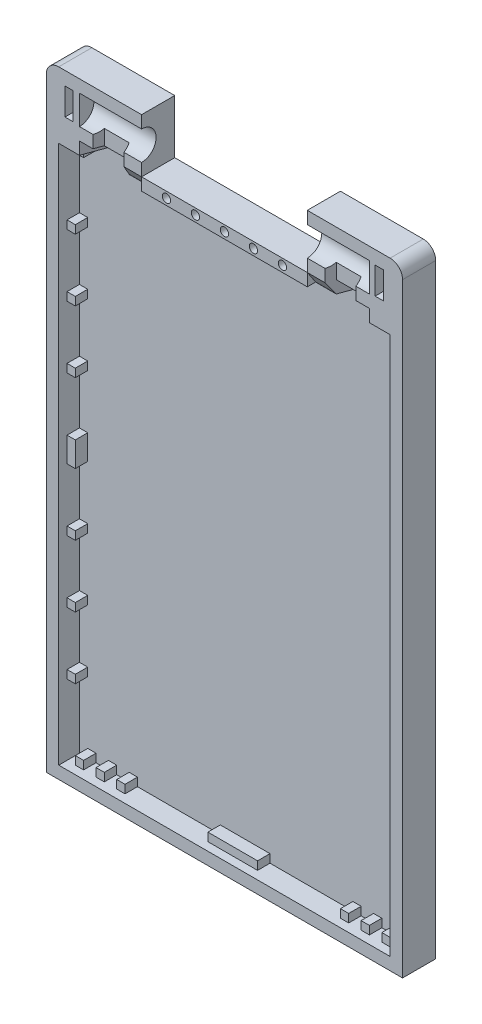
from build123d import *
from OCP.BRepFilletAPI import BRepFilletAPI_MakeChamfer

# Parameters (mm, degrees)
Y_KSEKLIK_EKSTR_ZYON1_DEPTH  = 8
IZIM1_4_W                    = 20
IZIM1_4_H                    = 13
IZIM1_4_W_2                  = 2
IZIM1_4_H_2                  = 6.5
Y_KSEKLIK_EKSTR_ZYON3_DEPTH  = 8
Y_KSEKLIK_EKSTR_ZYON4_DEPTH  = 3
Y_KSEKLIK_EKSTR_ZYON5_DEPTH  = 6
KES_EKSTR_ZYON1_DEPTH        = 15
KES_EKSTR_ZYON2_START        = 55
KES_EKSTR_ZYON2_DEPTH        = 55
IZIM7_W                      = 6
IZIM7_H                      = 4
KES_EKSTR_ZYON5_DEPTH        = 2
PAH1_SIZE2                   = 3
PAH1_SIZE                    = 1.091910703
PAH2_SIZE2                   = 3
PAH2_SIZE                    = 1.091910703
PAH3_SIZE                    = 1.819851171
PAH3_SIZE_2                  = 5
PAH4_SIZE                    = 0.727940469
PAH4_SIZE_2                  = 2
PAH5_SIZE                    = 2
PAH5_SIZE_2                  = 2.965121937
IZIM11_R                     = 1
Y_KSEKLIK_EKSTR_ZYON10_DEPTH = 2
IZIM12_W                     = 2
IZIM12_H                     = 6
IZIM12_H_2                   = 2
IZIM12_W_2                   = 12
Y_KSEKLIK_EKSTR_ZYON12_DEPTH = 3


# Some blends are built 0.0001 mm under size
with BuildPart() as part:
    # Çizim1 → Yükseklik-Ekstrüzyon1 (new body)
    with BuildSketch(Plane.XY):
        with BuildLine():
            Line((-27.993672713, -28.466538806), (-27.993672713, 101.533461194))
            Line((-27.993672713, 101.533461194), (-22.993672713, 101.533461194))
            Line((-22.993672713, 101.533461194), (-22.993672713, 104.533461194))
            Line((-22.993672713, 104.533461194), (-27.993672713, 104.533461194))
            Line((-27.993672713, 104.533461194), (-27.993672713, 117.533461194))
            ThreePointArc((-27.993672713, 117.533461194), (-30.114993056, 116.654781538), (-30.993672713, 114.533461194))
            Line((-30.993672713, 114.533461194), (-30.993672713, 104.533461194))
            Line((-30.993672713, 104.533461194), (-30.993672713, -31.466538806))
            Line((-30.993672713, -31.466538806), (55.006327287, -31.466538806))
            Line((55.006327287, -31.466538806), (55.006327287, 104.533461194))
            Line((55.006327287, 104.533461194), (55.006327287, 114.533461194))
            ThreePointArc((55.006327287, 114.533461194), (54.127647631, 116.654781538), (52.006327287, 117.533461194))
            Line((52.006327287, 117.533461194), (52.006327287, 104.533461194))
            Line((52.006327287, 104.533461194), (47.006327287, 104.533461194))
            Line((47.006327287, 104.533461194), (47.006327287, 101.533461194))
            Line((47.006327287, 101.533461194), (52.006327287, 101.533461194))
            Line((52.006327287, 101.533461194), (52.006327287, -28.466538806))
            Line((52.006327287, -28.466538806), (-27.993672713, -28.466538806))
        make_face()
    extrude(amount=Y_KSEKLIK_EKSTR_ZYON1_DEPTH)

    # Çizim1<4> → Yükseklik-Ekstrüzyon3 (add)
    # profile 1 of 2: a face of its own
    with BuildSketch(Plane.XY):
        with Locations((-17.993672713, 111.033461194)):
            Rectangle(IZIM1_4_W, IZIM1_4_H)
        with Locations((-25.493672713, 111.033461194)):
            Rectangle(IZIM1_4_W_2, IZIM1_4_H_2, mode=Mode.SUBTRACT)
    # profile 2 of 2: a face of its own
    with BuildSketch(Plane.XY):
        with Locations((42.006327287, 111.033461194)):
            Rectangle(IZIM1_4_W, IZIM1_4_H)
        with Locations((49.389217742, 111.033461194)):
            Rectangle(IZIM1_4_W_2, IZIM1_4_H_2, mode=Mode.SUBTRACT)
    extrude(amount=Y_KSEKLIK_EKSTR_ZYON3_DEPTH)

    # Çizim1<6> → Yükseklik-Ekstrüzyon4 (add)
    with BuildSketch(Plane.XY):
        Polygon((-12.993672713, 101.533461194), (37.006327287, 101.533461194), (37.006327287, 104.533461194), (47.006327287, 104.533461194), (47.006327287, 101.533461194), (52.006327287, 101.533461194), (52.006327287, -28.466538806), (-27.993672713, -28.466538806), (-27.993672713, 101.533461194), (-22.993672713, 101.533461194), (-22.993672713, 104.533461194), (-12.993672713, 104.533461194), align=None)
    extrude(amount=Y_KSEKLIK_EKSTR_ZYON4_DEPTH)

    # Çizim1<7> → Yükseklik-Ekstrüzyon5 (add)
    with BuildSketch(Plane.XY):
        Polygon((-12.993672713, 104.533461194), (-12.993672713, 101.533461194), (37.006327287, 101.533461194), (37.006327287, 104.533461194), (32.006327287, 104.533461194), (-7.993672713, 104.533461194), align=None)
    extrude(amount=Y_KSEKLIK_EKSTR_ZYON5_DEPTH)

    # Çizim2 → Kes-Ekstrüzyon1 (cut)
    with BuildSketch(Plane.ZY.offset(-32.006327287)):
        with BuildLine():
            Line((8, 107.533461194), (8, 114.533461194))
            ThreePointArc((8, 114.533461194), (4.5, 111.033461194), (8, 107.533461194))
        make_face()
    extrude(amount=-KES_EKSTR_ZYON1_DEPTH, mode=Mode.SUBTRACT)

    # Çizim2<3> → Kes-Ekstrüzyon2 (cut)
    with BuildSketch(Plane.ZY.offset(-32.006327287).offset(KES_EKSTR_ZYON2_START)):
        with BuildLine():
            Line((8, 107.533461194), (8, 114.533461194))
            ThreePointArc((8, 114.533461194), (4.5, 111.033461194), (8, 107.533461194))
        make_face()
    extrude(amount=-KES_EKSTR_ZYON2_DEPTH, mode=Mode.SUBTRACT)

    # Çizim7 → Kes-Ekstrüzyon5 (cut)
    with BuildSketch(Plane.XY.offset(8)):
        with Locations((-15.993672713, 106.533461194)):
            Rectangle(IZIM7_W, IZIM7_H)
        with Locations((40.006327287, 106.533461194)):
            Rectangle(IZIM7_W, IZIM7_H)
    extrude(amount=-KES_EKSTR_ZYON5_DEPTH, mode=Mode.SUBTRACT)

    # Pah1
    pah1_edges = [part.edges().sort_by_distance(p)[0] for p in [
        (37.006327287, 103.033461194, 3),
    ]]
    pah1_side = [part.faces().sort_by_distance(p)[0] for p in [
        (37.028165501, 103.033461194, 3),
    ]]
    chamfer(pah1_edges, length=PAH1_SIZE - 0.0001, length2=PAH1_SIZE2 - 0.0001, reference=pah1_side[0])  # a hair under: the kernel refuses the full size

    # Pah2
    pah2_edges = [part.edges().sort_by_distance(p)[0] for p in [
        (-12.993672713, 103.033461194, 3),
    ]]
    pah2_side = [part.faces().sort_by_distance(p)[0] for p in [
        (-13.015510927, 103.033461194, 3),
    ]]
    chamfer(pah2_edges, length=PAH2_SIZE - 0.0001, length2=PAH2_SIZE2 - 0.0001, reference=pah2_side[0])  # a hair under: the kernel refuses the full size

    # Pah3
    pah3_edges_1 = [part.edges().sort_by_distance(p)[0] for p in [
        (47.006327287, 103.033461194, 3),
    ]]
    pah3_side_1 = [part.faces().sort_by_distance(p)[0] for p in [
        (46.969930264, 103.033461194, 3),
    ]]
    pah3_edges_2 = [part.edges().sort_by_distance(p)[0] for p in [
        (-22.993672713, 103.033461194, 3),
    ]]
    pah3_side_2 = [part.faces().sort_by_distance(p)[0] for p in [
        (-22.957275689, 103.033461194, 3),
    ]]
    pah3 = BRepFilletAPI_MakeChamfer(part.part.solid().wrapped)
    for e in pah3_edges_1:
        pah3.Add(PAH3_SIZE - 0.0001, PAH3_SIZE_2 - 0.0001, e.wrapped, pah3_side_1[0].wrapped)
    for e in pah3_edges_2:
        pah3.Add(PAH3_SIZE - 0.0001, PAH3_SIZE_2 - 0.0001, e.wrapped, pah3_side_2[0].wrapped)
    add(Compound.cast(pah3.Shape()), mode=Mode.REPLACE)  # a hair under: the kernel refuses the full size

    # Pah4
    pah4_edges_1 = [part.edges().sort_by_distance(p)[0] for p in [
        (-18.993672713, 106.033461194, 8),
    ]]
    pah4_side_1 = [part.faces().sort_by_distance(p)[0] for p in [
        (-19.008231522, 106.033461194, 8),
    ]]
    pah4_edges_2 = [part.edges().sort_by_distance(p)[0] for p in [
        (-12.993672713, 106.033461194, 8),
    ]]
    pah4_side_2 = [part.faces().sort_by_distance(p)[0] for p in [
        (-12.993672713, 106.033461194, 7.985441191),
    ]]
    pah4_edges_3 = [part.edges().sort_by_distance(p)[0] for p in [
        (37.006327287, 106.033461194, 8),
    ]]
    pah4_side_3 = [part.faces().sort_by_distance(p)[0] for p in [
        (36.991768478, 106.033461194, 8),
    ]]
    pah4_edges_4 = [part.edges().sort_by_distance(p)[0] for p in [
        (43.006327287, 106.033461194, 8),
    ]]
    pah4_side_4 = [part.faces().sort_by_distance(p)[0] for p in [
        (43.020886097, 106.033461194, 8),
    ]]
    pah4 = BRepFilletAPI_MakeChamfer(part.part.solid().wrapped)
    for e in pah4_edges_1:
        pah4.Add(PAH4_SIZE - 0.0001, PAH4_SIZE_2 - 0.0001, e.wrapped, pah4_side_1[0].wrapped)
    for e in pah4_edges_2:
        pah4.Add(PAH4_SIZE_2 - 0.0001, PAH4_SIZE - 0.0001, e.wrapped, pah4_side_2[0].wrapped)
    for e in pah4_edges_3:
        pah4.Add(PAH4_SIZE - 0.0001, PAH4_SIZE_2 - 0.0001, e.wrapped, pah4_side_3[0].wrapped)
    for e in pah4_edges_4:
        pah4.Add(PAH4_SIZE - 0.0001, PAH4_SIZE_2 - 0.0001, e.wrapped, pah4_side_4[0].wrapped)
    add(Compound.cast(pah4.Shape()), mode=Mode.REPLACE)  # a hair under: the kernel refuses the full size

    # Pah5
    # the kernel refuses this chamfer: 2.965121937, 2 mm, written as the material it adds along each edge
    with BuildSketch(Plane(origin=(-12.993672713, 104.533461194, 6), x_dir=(0, 0.04753214298803266, 0.9988697089125113), z_dir=(1, 0, 0))) as pah5_piece_1_section:
        Polygon((PAH5_SIZE * 0.998869708913, PAH5_SIZE * 0.047532142988), (-PAH5_SIZE_2 * 0.0475321429884, PAH5_SIZE_2 * 0.998869708921), (0, 0), align=None)
    pah5_piece_1 = extrude(amount=5, mode=Mode.PRIVATE)
    pah5_piece_1 = split(pah5_piece_1, bisect_by=Plane(origin=(-12.478695836, 103.532485568, 7.41511098), z_dir=(0.9397022253347452, 0, -0.3419937538916869)), keep=Keep.TOP, mode=Mode.PRIVATE)
    add(pah5_piece_1)
    with BuildSketch(Plane(origin=(32.006327287, 104.533461194, 6), x_dir=(0, 0.04753214298802581, 0.9988697089125117), z_dir=(1, 0, 0))) as pah5_piece_2_section:
        Polygon((PAH5_SIZE * 0.998869708913, PAH5_SIZE * 0.047532142988), (-PAH5_SIZE_2 * 0.0475321429884, PAH5_SIZE_2 * 0.998869708921), (0, 0), align=None)
    pah5_piece_2 = extrude(amount=5, mode=Mode.PRIVATE)
    pah5_piece_2 = split(pah5_piece_2, bisect_by=Plane(origin=(36.491350411, 103.532485568, 7.41511098), z_dir=(-0.9397022253347452, 0, -0.3419937538916869)), keep=Keep.TOP, mode=Mode.PRIVATE)
    add(pah5_piece_2)

    # Çizim11 → Yükseklik-Ekstrüzyon10 (add)
    with BuildSketch(Plane.XY.offset(6)):
        Polygon((32.006327287, 104.533461194), (-7.993672713, 104.533461194), (-7.993672713, 101.568339257), (-7.993672713, 101.533461194), (32.006327287, 101.533461194), (32.006327287, 101.568339257), align=None)
        with Locations(Location((-1.993672713, 103.050900226, 0), (0, 0, 180))):
            Circle(IZIM11_R, mode=Mode.SUBTRACT)
        with Locations(Location((5.006327287, 103.050900226, 0), (0, 0, 180))):
            Circle(IZIM11_R, mode=Mode.SUBTRACT)
        with Locations(Location((12.006327287, 103.050900226, 0), (0, 0, 180))):
            Circle(IZIM11_R, mode=Mode.SUBTRACT)
        with Locations(Location((19.006327287, 103.050900226, 0), (0, 0, 180))):
            Circle(IZIM11_R, mode=Mode.SUBTRACT)
        with Locations(Location((26.006327287, 103.050900226, 0), (0, 0, 180))):
            Circle(IZIM11_R, mode=Mode.SUBTRACT)
    extrude(amount=Y_KSEKLIK_EKSTR_ZYON10_DEPTH)

    # Çizim12 → Yükseklik-Ekstrüzyon12 (add)
    with BuildSketch(Plane.XY.offset(3)):
        with Locations((-26.993672713, 36.533461194)):
            Rectangle(IZIM12_W, IZIM12_H)
        with Locations((-26.993672713, 53.533461194)):
            Rectangle(IZIM12_W, IZIM12_H_2)
        with Locations((-26.993672713, 68.533461194)):
            Rectangle(IZIM12_W, IZIM12_H_2)
        with Locations((-26.993672713, 83.533461194)):
            Rectangle(IZIM12_W, IZIM12_H_2)
        with Locations((-24.993672713, 100.533461194)):
            Rectangle(IZIM12_W, IZIM12_H_2)
        with Locations((49.006327287, 100.533461194)):
            Rectangle(IZIM12_W, IZIM12_H_2)
        with Locations((51.006327287, 83.533461194)):
            Rectangle(IZIM12_W, IZIM12_H_2)
        with Locations((51.006327287, 68.533461194)):
            Rectangle(IZIM12_W, IZIM12_H_2)
        with Locations((51.006327287, 53.533461194)):
            Rectangle(IZIM12_W, IZIM12_H_2)
        with Locations((51.006327287, 36.533461194)):
            Rectangle(IZIM12_W, IZIM12_H)
        with Locations((51.006327287, 19.533461194)):
            Rectangle(IZIM12_W, IZIM12_H_2)
        with Locations((51.006327287, 4.533461194)):
            Rectangle(IZIM12_W, IZIM12_H_2)
        with Locations((51.006327287, -10.466538806)):
            Rectangle(IZIM12_W, IZIM12_H_2)
        with Locations((49.006327287, -27.466538806)):
            Rectangle(IZIM12_W, IZIM12_H_2)
        with Locations((44.006327287, -27.466538806)):
            Rectangle(IZIM12_W, IZIM12_H_2)
        with Locations((39.006327287, -27.466538806)):
            Rectangle(IZIM12_W, IZIM12_H_2)
        with Locations((12.006327287, -27.466538806)):
            Rectangle(IZIM12_W_2, IZIM12_H_2)
        with Locations((-14.993672713, -27.466538806)):
            Rectangle(IZIM12_W, IZIM12_H_2)
        with Locations((-19.993672713, -27.466538806)):
            Rectangle(IZIM12_W, IZIM12_H_2)
        with Locations((-24.993672713, -27.466538806)):
            Rectangle(IZIM12_W, IZIM12_H_2)
        with Locations((-26.993672713, -10.466538806)):
            Rectangle(IZIM12_W, IZIM12_H_2)
        with Locations((-26.993672713, 4.533461194)):
            Rectangle(IZIM12_W, IZIM12_H_2)
        with Locations((-26.993672713, 19.533461194)):
            Rectangle(IZIM12_W, IZIM12_H_2)
    extrude(amount=Y_KSEKLIK_EKSTR_ZYON12_DEPTH)


solid = part.part
